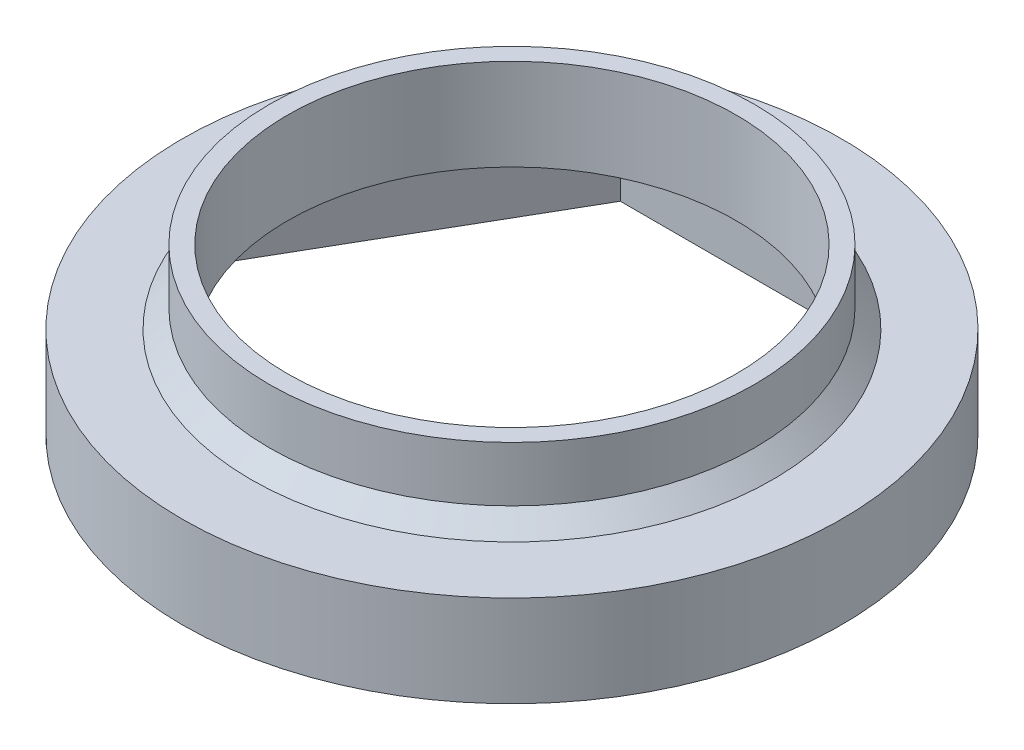
from build123d import *

# Parameters (mm, degrees)
SKETCH1_R           = 18
BOSS_EXTRUDE1_DEPTH = 4
SKETCH2_R           = 13.25
SKETCH2_R_2         = 12.25
BOSS_EXTRUDE2_DEPTH = 5
SKETCH3_R           = 18
SKETCH3_R_2         = 12.25
BOSS_EXTRUDE3_DEPTH = 1
CHAMFER1_SIZE       = 1


with BuildPart() as part:
    # Sketch1 → Boss-Extrude1 (new body)
    with BuildSketch(Plane(origin=(0, 0, 0), x_dir=(1, 0, 0), z_dir=(0, 1, 0))):
        Circle(SKETCH1_R)
        Polygon((8.082903769, -14), (16.165807537, 0), (8.082903769, 14), (-8.082903769, 14), (-16.165807537, 0), (-8.082903769, -14), align=None, mode=Mode.SUBTRACT)
    extrude(amount=BOSS_EXTRUDE1_DEPTH)



with BuildPart() as body_2:
    # Sketch2 → Boss-Extrude2 (new body)
    with BuildSketch(Plane(origin=(0, 4, 0), x_dir=(1, 0, 0), z_dir=(0, 1, 0))):
        Circle(SKETCH2_R)
        Circle(SKETCH2_R_2, mode=Mode.SUBTRACT)
    extrude(amount=BOSS_EXTRUDE2_DEPTH)


with BuildPart() as part_1:
    add(part.part)

    add(body_2.part)  # Boss-Extrude3 merges body 2
    # Sketch3 → Boss-Extrude3 (add)
    with BuildSketch(Plane(origin=(0, 4, 0), x_dir=(1, 0, 0), z_dir=(0, 1, 0))):
        Circle(SKETCH3_R)
        Circle(SKETCH3_R_2, mode=Mode.SUBTRACT)
    extrude(amount=BOSS_EXTRUDE3_DEPTH)

    # Chamfer1
    chamfer1_edges = [part_1.edges().sort_by_distance(p)[0] for p in [
        (-13.25, 5, 0),
    ]]
    chamfer(chamfer1_edges, length=CHAMFER1_SIZE)


solid = part_1.part
